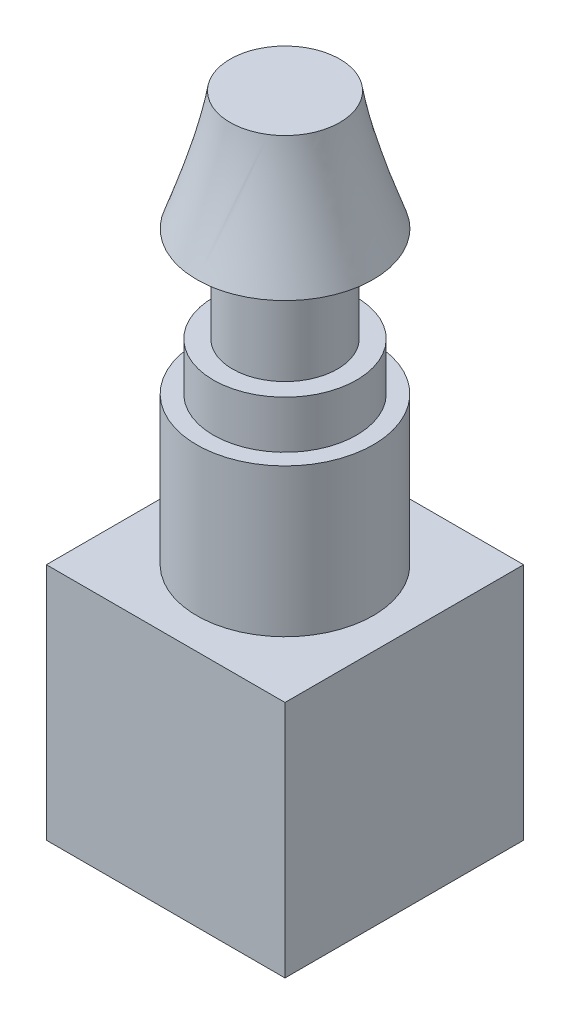
from build123d import *

# Parameters (mm, degrees)
SKETCH1_R           = 1.85
BOSS_EXTRUDE1_DEPTH = 3.1
SKETCH2_R           = 1.5
BOSS_EXTRUDE2_DEPTH = 1
SKETCH3_R           = 1.1
BOSS_EXTRUDE3_DEPTH = 2
SKETCH6_W           = 5
SKETCH6_H           = 5
BOSS_EXTRUDE4_DEPTH = 5
SKETCH7_R           = 0.9
CUT_EXTRUDE1_DEPTH  = 3


with BuildPart() as part:
    # Sketch1 → Boss-Extrude1 (new body)
    with BuildSketch(Plane(origin=(0, 0, 0), x_dir=(1, 0, 0), z_dir=(0, 1, 0))):
        with Locations(Location((0, 0, 0), (0, 0, 90))):
            Circle(SKETCH1_R)
    extrude(amount=BOSS_EXTRUDE1_DEPTH)

    # Sketch2 → Boss-Extrude2 (add)
    with BuildSketch(Plane(origin=(0, 3.1, 0), x_dir=(1, 0, 0), z_dir=(0, 1, 0))):
        with Locations(Location((0, 0, 0), (0, 0, 270))):
            Circle(SKETCH2_R)
    extrude(amount=BOSS_EXTRUDE2_DEPTH)

    # Sketch3 → Boss-Extrude3 (add)
    with BuildSketch(Plane(origin=(0, 4.1, 0), x_dir=(1, 0, 0), z_dir=(0, 1, 0))):
        with Locations(Location((0, 0, 0), (0, 0, 270))):
            Circle(SKETCH3_R)
    extrude(amount=BOSS_EXTRUDE3_DEPTH)

    # Loft1: read off the stored shape, not the designer's step
    # Loft1: loft between two sections, ruled curve by curve
    loft1_from = [
        Edge.make_bspline([(0, 6.1, 1.85), (3.7, 6.1, 1.85), (3.7, 6.1, -1.85), (0, 6.1, -1.85), (-3.7, 6.1, -1.85), (-3.7, 6.1, 1.85), (0, 6.1, 1.85)], [0, 0, 0, 0, 0.5, 0.5, 0.5, 1, 1, 1, 1], 3, [1, 0.333333333, 0.333333333, 1, 0.333333333, 0.333333333, 1]),
    ]
    loft1_to = [
        Edge.make_bspline([(0.620465421, 8.6, 0.968257539), (2.556980499, 8.6, -0.272673303), (1.316049657, 8.6, -2.209188381), (-0.620465421, 8.6, -0.968257539), (-2.556980499, 8.6, 0.272673303), (-1.316049657, 8.6, 2.209188381), (0.620465421, 8.6, 0.968257539)], [0, 0, 0, 0, 0.5, 0.5, 0.5, 1, 1, 1, 1], 3, [1, 0.333333333, 0.333333333, 1, 0.333333333, 0.333333333, 1]),
    ]
    loft1 = Solid(Shell([*[Face.make_surface_from_curves(loft1_from[k], loft1_to[k]) for k in range(1)], Face(Wire(loft1_from)), Face(Wire(loft1_to))]))
    add(loft1)

    # Sketch6 → Boss-Extrude4 (add)
    with BuildSketch(Plane.XZ):
        Rectangle(SKETCH6_W, SKETCH6_H)
    extrude(amount=BOSS_EXTRUDE4_DEPTH)

    # Sketch7 → Cut-Extrude1 (cut)
    with BuildSketch(Plane.XZ.offset(5)):
        with Locations(Location((0, 0, 0), (0, 0, 270))):
            Circle(SKETCH7_R)
    extrude(amount=-CUT_EXTRUDE1_DEPTH, mode=Mode.SUBTRACT)


solid = part.part
